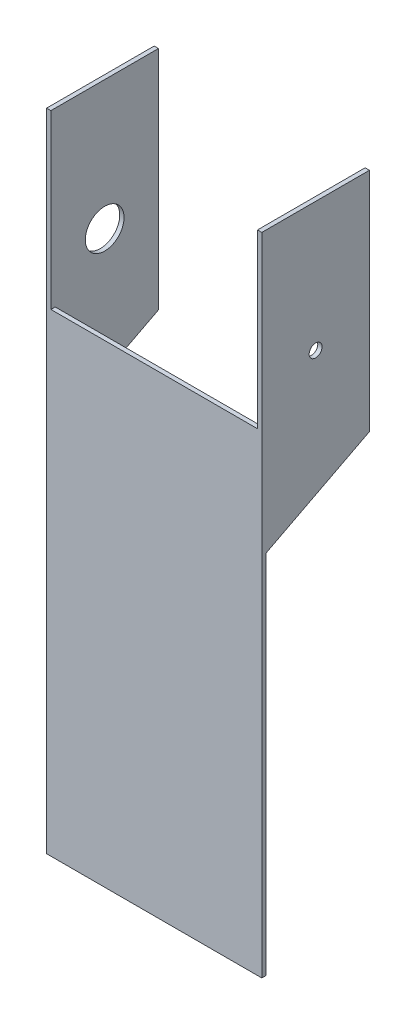
from build123d import *

# Parameters (mm, degrees)
CROQUIS2_W              = 50
CROQUIS2_H              = 150
SALIENTE_EXTRUIR1_DEPTH = 25
CROQUIS6_W              = 48
CROQUIS6_H              = 40
CORTAR_EXTRUIR1_DEPTH   = 25
VACIADO2_START          = -31.864905155
VACIADO2_OUTLINE_W      = 110
VACIADO2_OUTLINE_H      = 23
VACIADO2_DEPTH          = 48
CROQUIS8_R              = 4.5
CORTAR_EXTRUIR3_DEPTH   = 1
CROQUIS9_W              = 48
CROQUIS9_H              = 110
CORTAR_EXTRUIR4_DEPTH   = 10
CORTAR_EXTRUIR5_DEPTH   = 1
CORTAR_EXTRUIR6_DEPTH   = 1
CROQUIS12_R             = 1.5
CORTAR_EXTRUIR7_DEPTH   = 1


# Read off the part's stored shape, not the designer's step: Vaciado2
with BuildPart() as part:
    # Croquis2 → Saliente-Extruir1 (new body)
    with BuildSketch(Plane.XY):
        with Locations((-7.864905155, -22.416151752)):
            Rectangle(CROQUIS2_W, CROQUIS2_H)
    extrude(amount=SALIENTE_EXTRUIR1_DEPTH)

    # Croquis6 → Cortar-Extruir1 (cut)
    with BuildSketch(Plane(origin=(0, 0, 0), x_dir=(-1, 0, 0), z_dir=(0, 0, -1))):
        with Locations((7.864905155, 32.583848248)):
            Rectangle(CROQUIS6_W, CROQUIS6_H)
    extrude(amount=-CORTAR_EXTRUIR1_DEPTH, mode=Mode.SUBTRACT)

    # Vaciado2 outline → Vaciado2 (cut)
    with BuildSketch(Plane.YZ.offset(VACIADO2_START)):
        with Locations((-42.416151752, 12.5)):
            Rectangle(VACIADO2_OUTLINE_W, VACIADO2_OUTLINE_H)
    extrude(amount=VACIADO2_DEPTH, mode=Mode.SUBTRACT)

    # Croquis8 → Cortar-Extruir3 (cut)
    with BuildSketch(Plane.ZY.offset(32.864905155)):
        with Locations(Location((12.5, 22.583848248, 0), (0, 0, 270))):
            Circle(CROQUIS8_R)
    extrude(amount=-CORTAR_EXTRUIR3_DEPTH, mode=Mode.SUBTRACT)

    # Croquis9 → Cortar-Extruir4 (cut)
    with BuildSketch(Plane(origin=(0, 0, 0), x_dir=(-1, 0, 0), z_dir=(0, 0, -1))):
        with Locations((7.864905155, -42.416151752)):
            Rectangle(CROQUIS9_W, CROQUIS9_H)
    extrude(amount=-CORTAR_EXTRUIR4_DEPTH, mode=Mode.SUBTRACT)

    # Croquis10 → Cortar-Extruir5 (cut)
    with BuildSketch(Plane.ZY.offset(32.864905155)):
        Polygon((0, 0), (24, -12.416151752), (24, -97.416151752), (0, -97.416151752), align=None)
    extrude(amount=-CORTAR_EXTRUIR5_DEPTH, mode=Mode.SUBTRACT)

    # Croquis11 → Cortar-Extruir6 (cut)
    with BuildSketch(Plane(origin=(17.135094845, 0, 0), x_dir=(0, 0, -1), z_dir=(1, 0, 0))):
        Polygon((0, 0), (-24, -12.416151752), (-24, -97.416151752), (0, -97.416151752), align=None)
    extrude(amount=-CORTAR_EXTRUIR6_DEPTH, mode=Mode.SUBTRACT)

    # Croquis12 → Cortar-Extruir7 (cut)
    with BuildSketch(Plane(origin=(17.135094845, 0, 0), x_dir=(0, 0, -1), z_dir=(1, 0, 0))):
        with Locations(Location((-12.5, 22.583848248, 0), (0, 0, 90))):
            Circle(CROQUIS12_R)
    extrude(amount=-CORTAR_EXTRUIR7_DEPTH, mode=Mode.SUBTRACT)


solid = part.part
